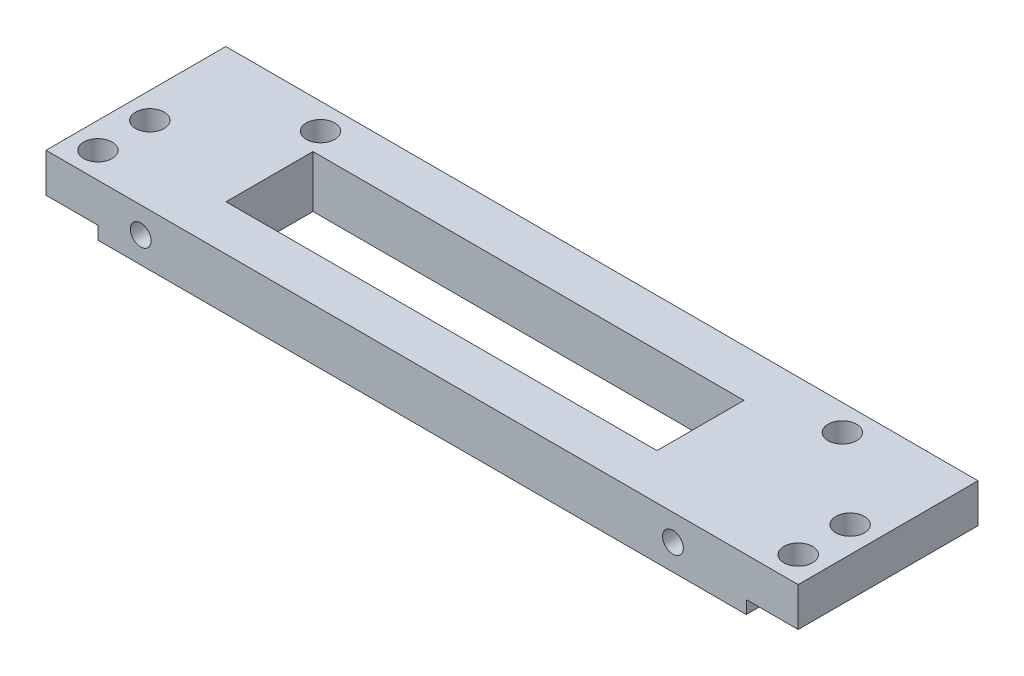
from build123d import *

# Parameters (mm, degrees)
MAIN_STOCK_START                         = 2.248090434
SKETCH_1_W                               = 57.95
SKETCH_1_H                               = 4
MAIN_STOCK_DEPTH                         = 8.851909566
SKETCH_2_W                               = 4
SKETCH_2_H                               = 1
CORNER_LEFT_RECTANGULAR_NOTCH_4X1_DEPTH  = 8.851909566
SKETCH_3_W                               = 4
SKETCH_3_H                               = 1
CORNER_RIGHT_RECTANGULAR_NOTCH_4X1_DEPTH = 8.851909566
SKETCH_4_R                               = 0.8
FRAME_2XD1P6_THROUGH_DEPTH               = 72.016485431
SKETCH_5_W                               = 33.203
SKETCH_5_H                               = 6.7
MERGED_INTERFACE_WINDOW_33P203X6P7_DEPTH = 4
SKETCH_6_R                               = 1.1
CORNER_REAR_4XD2P2_THROUGH_DEPTH         = 55.932071689
WALL_EXTENSION_TO_FLOOR_DEPTH            = 5
SKETCH_8_W                               = 33.203
SKETCH_8_H                               = 6.7
REAR_WINDOW_FULL_33P203X6P7_DEPTH        = 4.01
SKETCH_9_R                               = 1.1
HORIZONTAL_BASE_M2_1_0_04568_DEPTH       = 4.01


with BuildPart() as part:
    # 草图1 → Main_Stock (new body)
    with BuildSketch(Plane.XY.offset(MAIN_STOCK_START)):
        with Locations((24.675, 43.68)):
            Rectangle(SKETCH_1_W, SKETCH_1_H)
    extrude(amount=MAIN_STOCK_DEPTH)

    # 草图2 → Corner_Left_Rectangular_Notch_4x1 (cut)
    with BuildSketch(Plane.XY.offset(11.1)):
        with Locations((-2.3, 42.18)):
            Rectangle(SKETCH_2_W, SKETCH_2_H)
    extrude(amount=-CORNER_LEFT_RECTANGULAR_NOTCH_4X1_DEPTH, mode=Mode.SUBTRACT)

    # 草图3 → Corner_Right_Rectangular_Notch_4x1 (cut)
    with BuildSketch(Plane.XY.offset(11.1)):
        with Locations((51.65, 42.18)):
            Rectangle(SKETCH_3_W, SKETCH_3_H)
    extrude(amount=-CORNER_RIGHT_RECTANGULAR_NOTCH_4X1_DEPTH, mode=Mode.SUBTRACT)

    # 草图4 → Frame_2xD1p6_Through (cut, through all)
    with BuildSketch(Plane.XY.offset(11.1)):
        with Locations((3, 43.68)):
            Circle(SKETCH_4_R)
        with Locations((44, 43.68)):
            Circle(SKETCH_4_R)
    extrude(amount=-FRAME_2XD1P6_THROUGH_DEPTH, mode=Mode.SUBTRACT)

    # 草图5 → Merged_Interface_Window_33p203x6p7 (cut)
    with BuildSketch(Plane(origin=(0, 45.68, 0), x_dir=(1, 0, 0), z_dir=(0, 1, 0))):
        with Locations((22.6715, -4.25)):
            Rectangle(SKETCH_5_W, SKETCH_5_H)
    extrude(amount=-MERGED_INTERFACE_WINDOW_33P203X6P7_DEPTH, mode=Mode.SUBTRACT)

    # 草图6 → Corner_Rear_4xD2p2_Through (cut, through all)
    with BuildSketch(Plane(origin=(0, 45.68, 0), x_dir=(1, 0, 0), z_dir=(0, 1, 0))):
        with Locations((-2.3, -5.1)):
            Circle(SKETCH_6_R)
        with Locations((-2.3, -9.1)):
            Circle(SKETCH_6_R)
        with Locations((51.65, -5.1)):
            Circle(SKETCH_6_R)
        with Locations((51.65, -9.1)):
            Circle(SKETCH_6_R)
    extrude(amount=-CORNER_REAR_4XD2P2_THROUGH_DEPTH, mode=Mode.SUBTRACT)

    # 草图7 → Wall_Extension_To_Floor (add)
    with BuildSketch(Plane(origin=(0, 0, 2.248090434), x_dir=(-1, 0, 0), z_dir=(0, 0, -1))):
        Polygon((4.3, 42.68), (0.3, 42.68), (0.3, 41.68), (-49.65, 41.68), (-49.65, 42.68), (-53.65, 42.68), (-53.65, 45.68), (4.3, 45.68), align=None)
    extrude(amount=WALL_EXTENSION_TO_FLOOR_DEPTH)

    # 草图8 → Rear_Window_Full_33p203x6p7 (cut)
    with BuildSketch(Plane(origin=(0, 45.68, 0), x_dir=(1, 0, 0), z_dir=(0, 1, 0))):
        with Locations((22.6715, -4.25)):
            Rectangle(SKETCH_8_W, SKETCH_8_H)
    extrude(amount=-REAR_WINDOW_FULL_33P203X6P7_DEPTH, mode=Mode.SUBTRACT)

    # 草图9 → Horizontal_Base_M2_1_0.04568 (cut)
    with BuildSketch(Plane(origin=(0, 45.68, 0), x_dir=(1, 0, 0), z_dir=(0, 1, 0))):
        with Locations((5, 0.75)):
            Circle(SKETCH_9_R)
        with Locations((45.2, 0.75)):
            Circle(SKETCH_9_R)
    extrude(amount=-HORIZONTAL_BASE_M2_1_0_04568_DEPTH, mode=Mode.SUBTRACT)


solid = part.part
